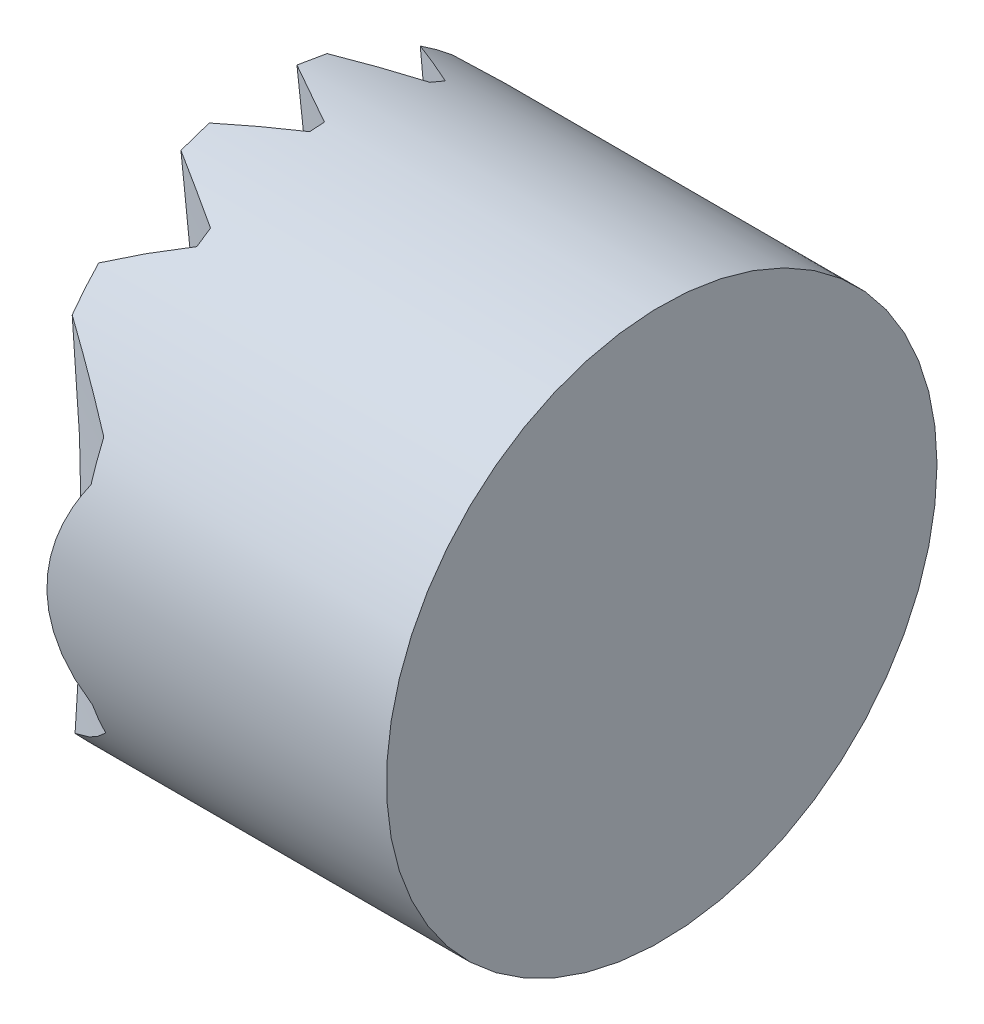
from build123d import *

# Parameters (mm, degrees)
CROQUIS1_R                 = 31.5
CROQUIS1_R_2               = 26.25
SALIENTE_EXTRUIR1_DEPTH    = 30
ROSCA1_PITCH               = 1.5
CORTAR_EXTRUIR1_DEPTH      = 77.558801329
CORTAR_EXTRUIR1_DEPTH_BACK = 77.558801329
CROQUIS4_R                 = 50.692956163
CROQUIS4_R_2               = 3.5
CROQUIS12_W                = 24.43841677
CROQUIS12_H                = 20.224896637
CORTAR_EXTRUIR7_DEPTH      = 37.698092739
CROQUIS6_R                 = 4
SALIENTE_EXTRUIR2_DEPTH    = 0.5
CROQUIS11_R                = 10.365890774
CORTAR_EXTRUIR5_DEPTH      = 0.5


with BuildPart() as part:
    # Croquis1 → Saliente-Extruir1 (new body)
    with BuildSketch(Plane.XY):
        Circle(CROQUIS1_R)
        Circle(CROQUIS1_R_2, mode=Mode.SUBTRACT)
    extrude(amount=SALIENTE_EXTRUIR1_DEPTH)

    # Rosca1: the profile of Perfil de rosca1 profile screwed along a right-hand helix of 46.666667 turns, 8 arcs to a turn; built about Z, then put on its axis
    rosca1_z = Axis((0, 0, 0), (0, 0, 1))
    rosca1_corners = [(26.2497, 0, -0.000173205), (27.061898812, 0, 0.468749998), (27.061898812, 0, 0.656249998), (26.2497, 0, 1.125173201)]
    with BuildLine(mode=Mode.PRIVATE) as rosca1_profile:
        Line(rosca1_corners[0], rosca1_corners[1])
        Line(rosca1_corners[1], rosca1_corners[2])
        Line(rosca1_corners[2], rosca1_corners[3])
        Line(rosca1_corners[3], rosca1_corners[0])
    rosca1_cap = Face(rosca1_profile.wire())
    rosca1_turn_angles = [0, 22.5, 45, 67.5, 90, 112.5, 135, 157.5, 180, 202.5, 225, 247.5, 270, 292.5, 315, 337.5, 360, 382.5, 405, 427.5, 450, 472.5, 495, 517.5, 540, 562.5, 585, 607.5, 630, 652.5, 675, 697.5, 720]
    rosca1_turn_weights = [1, 0.9238795325112867, 1, 0.9238795325112867, 1, 0.9238795325112867, 1, 0.9238795325112867, 1, 0.9238795325112867, 1, 0.9238795325112867, 1, 0.9238795325112867, 1, 0.9238795325112867, 1, 0.9238795325112867, 1, 0.9238795325112867, 1, 0.9238795325112867, 1, 0.9238795325112867, 1, 0.9238795325112867, 1, 0.9238795325112867, 1, 0.9238795325112867, 1, 0.9238795325112867, 1]
    rosca1_turn_rails = [Edge.make_bspline([Vector(p[0], p[1], 0).rotate(rosca1_z, rosca1_turn_angles[k]) / rosca1_turn_weights[k] + Vector(0, 0, p[2] + ROSCA1_PITCH * rosca1_turn_angles[k] / 360) for k in range(33)], [0, 0, 0, 1, 1, 2, 2, 3, 3, 4, 4, 5, 5, 6, 6, 7, 7, 8, 8, 9, 9, 10, 10, 11, 11, 12, 12, 13, 13, 14, 14, 15, 15, 16, 16, 16], 2, rosca1_turn_weights) for p in rosca1_corners]
    rosca1_turn_sides = [Face.make_surface_from_curves(rosca1_turn_rails[p[0]], rosca1_turn_rails[p[1]]) for p in [(0, 1), (1, 2), (2, 3), (3, 0)]]
    rosca1_last_angles = [16560, 16582.5, 16605, 16627.5, 16650, 16672.5, 16695, 16717.5, 16740, 16762.5, 16785, 16792.5, 16800]
    rosca1_last_weights = [1, 0.9238795325112867, 1, 0.9238795325112867, 1, 0.9238795325112867, 1, 0.9238795325112867, 1, 0.9238795325112867, 1, 0.9914448613738146, 1]
    rosca1_last_rails = [Edge.make_bspline([Vector(p[0], p[1], 0).rotate(rosca1_z, rosca1_last_angles[k]) / rosca1_last_weights[k] + Vector(0, 0, p[2] + ROSCA1_PITCH * rosca1_last_angles[k] / 360) for k in range(13)], [0, 0, 0, 1, 1, 2, 2, 3, 3, 4, 4, 5, 5, 6, 6, 6], 2, rosca1_last_weights) for p in rosca1_corners]
    rosca1_last_sides = [Face.make_surface_from_curves(rosca1_last_rails[p[0]], rosca1_last_rails[p[1]]) for p in [(0, 1), (1, 2), (2, 3), (3, 0)]]
    rosca1 = Plane(origin=(0, 0, 30), x_dir=(-1, 0, 0), z_dir=(0, 0, -1)) * Solid(Shell([*[p.moved(Location((0, 0, 2 * ROSCA1_PITCH * i))) for i in range(23) for p in rosca1_turn_sides], *rosca1_last_sides, rosca1_cap, rosca1_cap.rotate(rosca1_z, 16800).moved(Location((0, 0, ROSCA1_PITCH * 16800 / 360)))]))
    add(rosca1, mode=Mode.SUBTRACT)

    # Croquis4 → Cortar-Extruir1 (cut, two sides: drawn at the far end of the back side and taken through both)
    with BuildSketch(Plane(origin=(31.5, 0, 0), x_dir=(0, 0, -1), z_dir=(1, 0, 0)).offset(-CORTAR_EXTRUIR1_DEPTH_BACK)):
        with Locations((-15, 0)):
            Circle(CROQUIS4_R)
        with Locations((-15, 0)):
            Circle(CROQUIS4_R_2, mode=Mode.SUBTRACT)
    extrude(amount=CORTAR_EXTRUIR1_DEPTH + CORTAR_EXTRUIR1_DEPTH_BACK, mode=Mode.SUBTRACT)


with BuildPart() as cortar_extruir1_piece_1:
    # of the separate pieces the step leaves, piece 1, a body of its own (cortar_extruir1_pieces)
    add(part.part.solids().sort_by_distance((-31.5, 0, 11.5))[0])

    # Croquis12 → Cortar-Extruir7 (cut, through all)
    with BuildSketch(Plane.XY):
        with Locations((-22.54233271, -0.842704026)):
            Rectangle(CROQUIS12_W, CROQUIS12_H)
    extrude(amount=CORTAR_EXTRUIR7_DEPTH, mode=Mode.SUBTRACT)


with BuildPart() as cortar_extruir1_piece_2:
    # of the separate pieces the step leaves, piece 2, a body of its own (cortar_extruir1_pieces)
    add(part.part.solids().sort_by_distance((31.5, 0, 11.5))[0])

    # Croquis6 → Saliente-Extruir2 (add)
    with BuildSketch(Plane(origin=(31.5, 0, 0), x_dir=(0, 0, -1), z_dir=(1, 0, 0))):
        with Locations((-15, 0)):
            Circle(CROQUIS6_R)
    extrude(amount=-SALIENTE_EXTRUIR2_DEPTH)

    # Croquis11 → Cortar-Extruir5 (cut)
    with BuildSketch(Plane(origin=(31.5, 0, 0), x_dir=(0, 0, -1), z_dir=(1, 0, 0))):
        with Locations((-15, 0)):
            Circle(CROQUIS11_R)
    extrude(amount=-CORTAR_EXTRUIR5_DEPTH, mode=Mode.SUBTRACT)


solid = cortar_extruir1_piece_2.part
